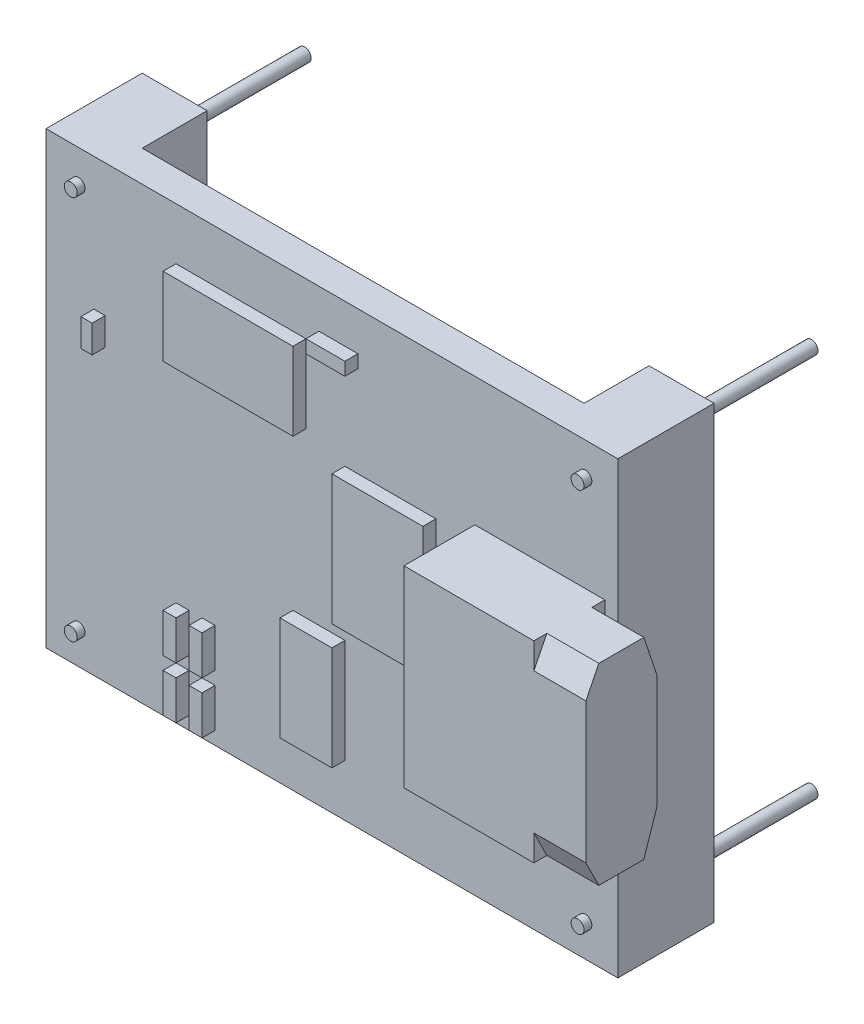
from build123d import *

# Parameters (mm, degrees)
ESQUISSE1_W             = 22
ESQUISSE1_H             = 17.3
BOSS_EXTRU_1_DEPTH      = 1.2
ESQUISSE2_W             = 7
ESQUISSE2_H             = 7.4
BOSS_EXTRU_2_DEPTH      = 2.73
ESQUISSE3_W             = 2.5
ESQUISSE3_H             = 17.3
BOSS_EXTRU_3_DEPTH      = 2.5
BOSS_EXTRU_4_DEPTH      = 5
BOSS_EXTRU_4_DEPTH_BACK = 4
ESQUISSE4_R             = 0.25
ESQUISSE5_W             = 2
ESQUISSE5_H             = 4
ESQUISSE5_W_2           = 0.5
ESQUISSE5_H_2           = 1.5
ESQUISSE5_W_3           = 5
ESQUISSE5_H_3           = 3
ESQUISSE5_W_4           = 1.5
ESQUISSE5_H_4           = 0.5
ESQUISSE5_W_5           = 0.43407564
ESQUISSE5_H_5           = 1.061073785
ESQUISSE5_W_6           = 3.5
ESQUISSE5_H_6           = 5
BOSS_EXTRU_5_DEPTH      = 0.5
ENL_V_MAT_EXTRU_4_DEPTH = 2


with BuildPart() as part:
    # Esquisse1 → Boss.-Extru.1 (new body)
    with BuildSketch(Plane.XY):
        with Locations((-11, 8.65)):
            Rectangle(ESQUISSE1_W, ESQUISSE1_H)
    extrude(amount=BOSS_EXTRU_1_DEPTH)

    # Esquisse2 → Boss.-Extru.2 (add)
    with BuildSketch(Plane.XY.offset(1.2)):
        with Locations((-2, 8.65)):
            Rectangle(ESQUISSE2_W, ESQUISSE2_H)
    extrude(amount=BOSS_EXTRU_2_DEPTH)

    # Esquisse3 → Boss.-Extru.3 (add)
    with BuildSketch(Plane(origin=(0, 0, 0), x_dir=(-1, 0, 0), z_dir=(0, 0, -1))):
        with Locations((1.25, 8.65)):
            Rectangle(ESQUISSE3_W, ESQUISSE3_H)
        with Locations((20.75, 8.65)):
            Rectangle(ESQUISSE3_W, ESQUISSE3_H)
    extrude(amount=BOSS_EXTRU_3_DEPTH)

    # Esquisse4 → Boss.-Extru.4 (add, two sides: drawn at the far end of the back side and taken through both)
    with BuildSketch(Plane(origin=(0, 0, -2.5), x_dir=(-1, 0, 0), z_dir=(0, 0, -1)).offset(-BOSS_EXTRU_4_DEPTH_BACK)):
        with Locations((1.25, 1.25)):
            Circle(ESQUISSE4_R)
        with Locations((1.25, 16.05)):
            Circle(ESQUISSE4_R)
        with Locations((20.75, 16.05)):
            Circle(ESQUISSE4_R)
        with Locations((20.75, 1.25)):
            Circle(ESQUISSE4_R)
    extrude(amount=BOSS_EXTRU_4_DEPTH + BOSS_EXTRU_4_DEPTH_BACK)

    # Esquisse5 → Boss.-Extru.5 (add)
    with BuildSketch(Plane.XY.offset(1.2)):
        with Locations((-11.5, 4)):
            Rectangle(ESQUISSE5_W, ESQUISSE5_H)
        with Locations((-15.75, 1.25)):
            Rectangle(ESQUISSE5_W_2, ESQUISSE5_H_2)
        with Locations((-16.75, 1.25)):
            Rectangle(ESQUISSE5_W_2, ESQUISSE5_H_2)
        with Locations((-15.75, 3.25)):
            Rectangle(ESQUISSE5_W_2, ESQUISSE5_H_2)
        with Locations((-16.75, 3.25)):
            Rectangle(ESQUISSE5_W_2, ESQUISSE5_H_2)
        with Locations((-14.5, 13.8)):
            Rectangle(ESQUISSE5_W_3, ESQUISSE5_H_3)
        with Locations((-10.75, 15.55)):
            Rectangle(ESQUISSE5_W_4, ESQUISSE5_H_4)
        with Locations((-19.944355947, 11.67647182)):
            Rectangle(ESQUISSE5_W_5, ESQUISSE5_H_5)
        with Locations((-8.75, 9.3)):
            Rectangle(ESQUISSE5_W_6, ESQUISSE5_H_6)
    extrude(amount=BOSS_EXTRU_5_DEPTH)

    # Esquisse8 → Enlèv. mat.-Extru.4 (cut)
    with BuildSketch(Plane(origin=(1.5, 0, 0), x_dir=(0, 0, -1), z_dir=(1, 0, 0))):
        Polygon((-1.2, 6.45), (-1.2, 4.95), (-1.7, 4.95), align=None)
        Polygon((-1.2, 10.85), (-1.7, 12.35), (-1.2, 12.35), align=None)
        Polygon((-3.93, 4.95), (-3.93, 5.95), (-3.43, 4.95), align=None)
        Polygon((-3.93, 11.35), (-3.43, 12.35), (-3.93, 12.35), align=None)
    extrude(amount=-ENL_V_MAT_EXTRU_4_DEPTH, mode=Mode.SUBTRACT)


solid = part.part
